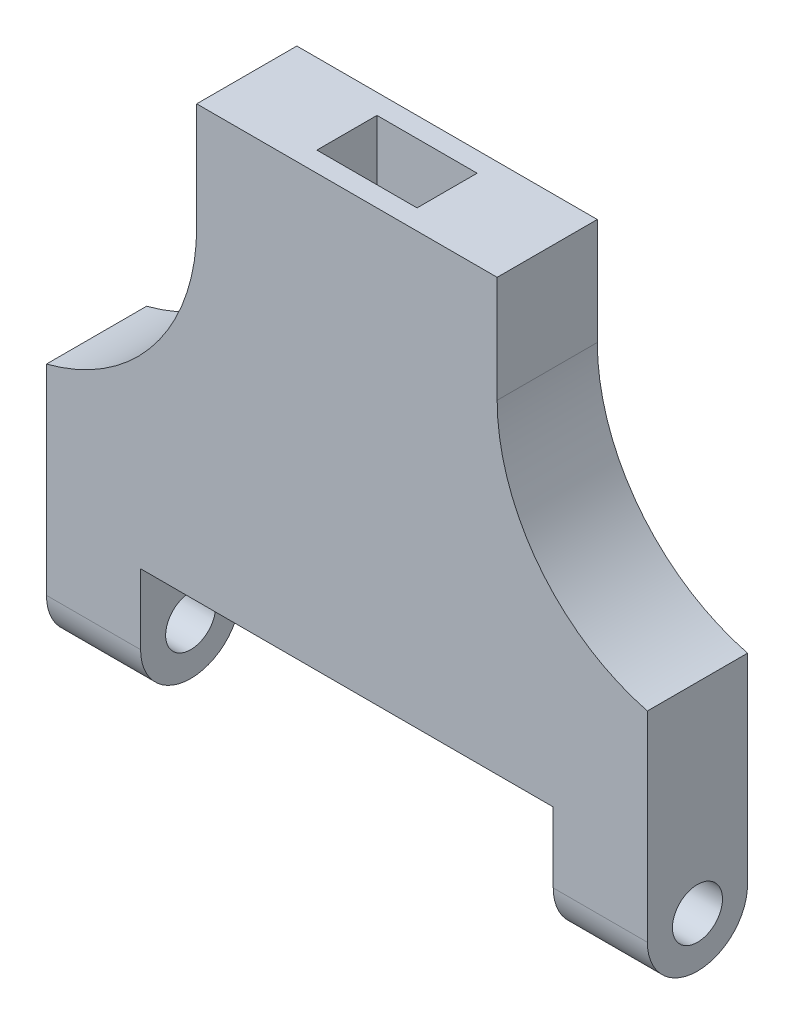
from build123d import *
from build123d.topology import SkipClean

# Parameters (mm, degrees)
SKETCH1_W           = 20
SKETCH1_H           = 60
BOSS_EXTRUDE1_DEPTH = 5
SKETCH2_R           = 2.5
SKETCH2_R_2         = 1.25
BOSS_EXTRUDE2_DEPTH = 20
CUT_EXTRUDE1_START  = -29
SKETCH3_R           = 1.25
CUT_EXTRUDE1_DEPTH  = 29
SKETCH4_R           = 2.5
SKETCH4_R_2         = 1.25
BOSS_EXTRUDE3_DEPTH = 20
CUT_EXTRUDE2_START  = -29
SKETCH5_R           = 1.25
CUT_EXTRUDE2_DEPTH  = 29
SKETCH6_R           = 1.25
BOSS_EXTRUDE4_DEPTH = 30
SKETCH7_W           = 20.6
SKETCH7_H           = 7
CUT_EXTRUDE3_DEPTH  = 30
SKETCH8_W           = 60.511546569
SKETCH8_H           = 78.563917263
CUT_EXTRUDE4_DEPTH  = 41
SKETCH13_W          = 15
SKETCH13_H          = 15
BOSS_EXTRUDE6_DEPTH = 5
FILLET1_R           = 10
SKETCH14_W          = 5
SKETCH14_H          = 3
CUT_EXTRUDE6_DEPTH  = 14


with BuildPart() as part:
    # Sketch1 → Boss-Extrude1 (new body)
    with BuildSketch(Plane.XY):
        with Locations((10, 30)):
            Rectangle(SKETCH1_W, SKETCH1_H)
    extrude(amount=BOSS_EXTRUDE1_DEPTH)

    # Sketch2 → Boss-Extrude2 (add)
    with BuildSketch(Plane(origin=(20, 0, 0), x_dir=(0, 0, -1), z_dir=(1, 0, 0))):
        with Locations((-2.5, 60)):
            Circle(SKETCH2_R)
        with Locations((-2.5, 60)):
            Circle(SKETCH2_R_2, mode=Mode.SUBTRACT)
    extrude(amount=-BOSS_EXTRUDE2_DEPTH)

    # Sketch3 → Cut-Extrude1 (cut)
    with SkipClean():  # the faces are left unmerged after this step: merging them gives an invalid solid
        with BuildSketch(Plane.ZY.offset(CUT_EXTRUDE1_START)):
            with Locations(Location((2.5, 60, 0), (0, 0, 180))):
                Circle(SKETCH3_R)
        extrude(amount=CUT_EXTRUDE1_DEPTH, mode=Mode.SUBTRACT)

    # Sketch4 → Boss-Extrude3 (add)
    with BuildSketch(Plane.ZY):
        with Locations((2.5, 0)):
            Circle(SKETCH4_R)
        with Locations((2.5, 0)):
            Circle(SKETCH4_R_2, mode=Mode.SUBTRACT)
    extrude(amount=-BOSS_EXTRUDE3_DEPTH)

    # Sketch5 → Cut-Extrude2 (cut)
    with SkipClean():  # the faces are left unmerged after this step: merging them gives an invalid solid
        with BuildSketch(Plane(origin=(20, 0, 0), x_dir=(0, 0, -1), z_dir=(1, 0, 0)).offset(CUT_EXTRUDE2_START)):
            with Locations(Location((-2.5, 0, 0), (0, 0, 180))):
                Circle(SKETCH5_R)
        extrude(amount=CUT_EXTRUDE2_DEPTH, mode=Mode.SUBTRACT)

    # Sketch6 → Boss-Extrude4 (add)
    with SkipClean():  # the faces are left unmerged after this step: merging them gives an invalid solid
        with BuildSketch(Plane.ZY):
            with BuildLine():
                Line((5, 60), (5, 70))
                Line((5, 70), (0, 70))
                Line((0, 70), (0, 60))
                ThreePointArc((0, 60), (2.5, 57.5), (5, 60))
            make_face()
            with Locations(Location((2.5, 60, 0), (0, 0, 180))):
                Circle(SKETCH6_R, mode=Mode.SUBTRACT)
        extrude(amount=BOSS_EXTRUDE4_DEPTH)

    # Sketch7 → Cut-Extrude3 (cut)
    with SkipClean():  # the faces are left unmerged after this step: merging them gives an invalid solid
        with BuildSketch(Plane(origin=(0, 0, 0), x_dir=(-1, 0, 0), z_dir=(0, 0, -1))):
            with Locations((15, 60)):
                Rectangle(SKETCH7_W, SKETCH7_H)
        extrude(amount=-CUT_EXTRUDE3_DEPTH, mode=Mode.SUBTRACT)

    # Sketch8 → Cut-Extrude4 (cut)
    with BuildSketch(Plane.ZY):
        with Locations((2.066743104, 31.078249137)):
            Rectangle(SKETCH8_W, SKETCH8_H)
    extrude(amount=-CUT_EXTRUDE4_DEPTH, mode=Mode.SUBTRACT)

    # Sketch13 → Boss-Extrude6 (add)
    with BuildSketch(Plane(origin=(0, 0, 0), x_dir=(-1, 0, 0), z_dir=(0, 0, -1))):
        with Locations((15, 77.5)):
            Rectangle(SKETCH13_W, SKETCH13_H)
    extrude(amount=-BOSS_EXTRUDE6_DEPTH)

    # Fillet1
    # the kernel refuses this fillet: 10 mm, written as the material it adds along each edge
    with BuildSketch(Plane(origin=(-22.5, 70, 0), x_dir=(-1, 0, 0), z_dir=(0, 0, 1))) as fillet1_piece_1:
        with BuildLine():
            CenterArc((10, -9.682458366), FILLET1_R, 104.477512186, 75.522487814)
            Line((0, -9.682458366), (-0.2, -9.682458366))
            Line((-0.2, -9.682458366), (-0.2, 0))
            Line((-0.2, 0), (0, 0.2))
            ThreePointArc((0, 0.2), (3.75, 0.2), (7.45, 0.193649167))
            Line((7.45, 0.193649167), (7.5, 0))
        make_face()
    extrude(amount=5)
    with BuildSketch(Plane(origin=(-7.5, 70, 0), x_dir=(1, 0, 0), z_dir=(0, 0, 1))) as fillet1_piece_2:
        with BuildLine():
            CenterArc((10, 9.682458366), FILLET1_R, 180, 75.522487814)
            Line((0, 9.682458366), (-0.2, 9.682458366))
            Line((-0.2, 9.682458366), (-0.2, 0))
            Line((-0.2, 0), (0, -0.2))
            ThreePointArc((0, -0.2), (3.75, -0.2), (7.45, -0.193649167))
            Line((7.45, -0.193649167), (7.5, 0))
        make_face()
    extrude(amount=5)

    # Sketch14 → Cut-Extrude6 (cut)
    with BuildSketch(Plane(origin=(0, 85, 0), x_dir=(1, 0, 0), z_dir=(0, 1, 0))):
        with Locations((-15, -2.5)):
            Rectangle(SKETCH14_W, SKETCH14_H)
    extrude(amount=-CUT_EXTRUDE6_DEPTH, mode=Mode.SUBTRACT)


solid = part.part
